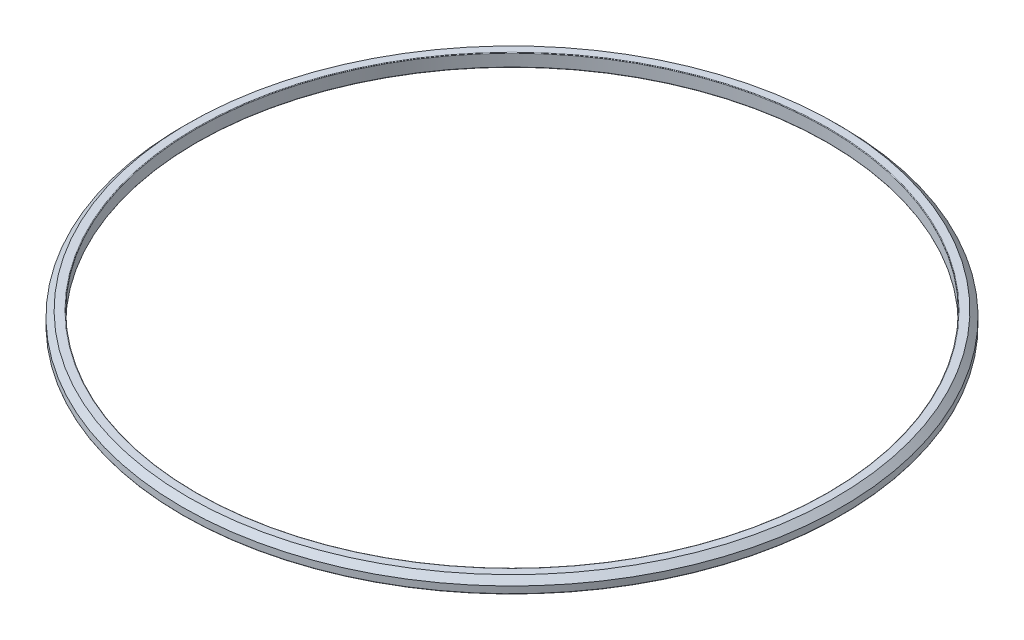
from build123d import *

# Parameters (mm, degrees)
SKETCH1_R           = 57.2125
SKETCH1_R_2         = 54.7875
BOSS_EXTRUDE1_DEPTH = 2.25
CHAMFER1_SIZE       = 1
FILLET1_R           = 0.1


with BuildPart() as part:
    # Sketch1 → Boss-Extrude1 (new body)
    with BuildSketch(Plane(origin=(0, 0, 0), x_dir=(1, 0, 0), z_dir=(0, 1, 0))):
        Circle(SKETCH1_R)
        Circle(SKETCH1_R_2, mode=Mode.SUBTRACT)
    extrude(amount=BOSS_EXTRUDE1_DEPTH)

    # Chamfer1
    chamfer1_edges = [part.edges().sort_by_distance(p)[0] for p in [
        (-57.2125, 2.25, 0),
    ]]
    chamfer(chamfer1_edges, length=CHAMFER1_SIZE)

    # Fillet1
    fillet1_edges = [part.edges().sort_by_distance(p)[0] for p in [
        (-54.7875, 2.25, 0),
        (-54.7875, 0, 0),
        (-57.2125, 0, 0),
    ]]
    fillet(fillet1_edges, radius=FILLET1_R)


solid = part.part
